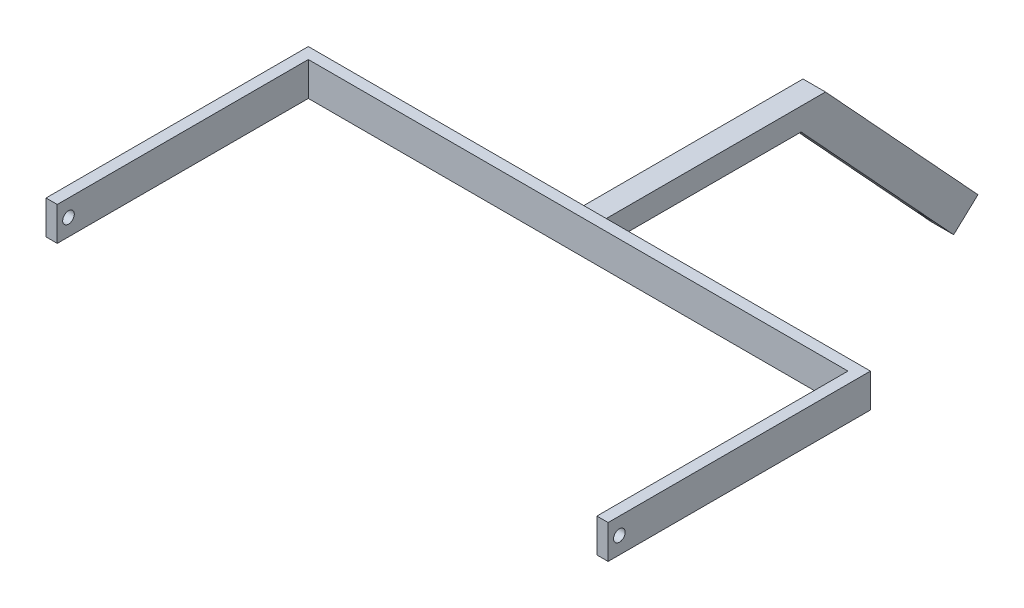
from build123d import *

# Parameters (mm, degrees)
EXTRUDE_2_DEPTH     = 6
SKETCH_2_R          = 1.55
CUT_EXTRUDE_1_DEPTH = 10
SKETCH_3_R          = 1.55
CUT_EXTRUDE_2_DEPTH = 10
EXTRUDE_4_DEPTH     = 1.5
EXTRUDE_5_DEPTH     = 1.5
SKETCH_5_W          = 6
SKETCH_5_H          = 6
EXTRUDE_6_DEPTH     = 60
CUT_EXTRUDE_3_DEPTH = 60
SKETCH_9_W          = 6
SKETCH_9_H          = 8.845903007
EXTRUDE_7_DEPTH     = 60
SKETCH_11_R         = 1.55
CUT_EXTRUDE_5_DEPTH = 10
SKETCH_10_W         = 5
SKETCH_10_H         = 6
CUT_EXTRUDE_6_DEPTH = 10


with BuildPart() as part:
    # 草图1 → 凸台-拉伸2 (new body)
    with BuildSketch(Plane(origin=(0, 0, 0), x_dir=(1, 0, 0), z_dir=(0, 1, 0))):
        Polygon((-72.757575758, -68.484848485), (-72.757575758, -1.484848485), (71.242424242, -1.484848485), (71.242424242, -68.484848485), (74.242424242, -68.484848485), (74.242424242, -1.484848485), (74.242424242, 1.515151515), (71.242424242, 1.515151515), (-72.757575758, 1.515151515), (-75.757575758, 1.515151515), (-75.757575758, -1.484848485), (-75.757575758, -68.484848485), align=None)
    extrude(amount=EXTRUDE_2_DEPTH)

    # 草图2 → 切除-拉伸1 (cut)
    with BuildSketch(Plane(origin=(-72.757575758, 0, 0), x_dir=(0, 0, -1), z_dir=(1, 0, 0))):
        with Locations((-65.484848485, 3)):
            Circle(SKETCH_2_R)
    extrude(amount=-CUT_EXTRUDE_1_DEPTH, mode=Mode.SUBTRACT)

    # 草图3 → 切除-拉伸2 (cut)
    with BuildSketch(Plane(origin=(74.242424242, 0, 0), x_dir=(0, 0, -1), z_dir=(1, 0, 0))):
        with Locations((-65.484848485, 3)):
            Circle(SKETCH_3_R)
    extrude(amount=-CUT_EXTRUDE_2_DEPTH, mode=Mode.SUBTRACT)

    # 草图6 → 凸台-拉伸4 (add)
    with BuildSketch(Plane(origin=(0, 6, 0), x_dir=(1, 0, 0), z_dir=(0, 1, 0))):
        Polygon((-75.757575758, 1.515151515), (74.242424242, 1.515151515), (74.242424242, -68.484848485), (71.242424242, -68.484848485), (71.242424242, -1.484848485), (-72.757575758, -1.484848485), (-72.757575758, -68.484848485), (-75.757575758, -68.484848485), align=None)
    extrude(amount=EXTRUDE_4_DEPTH)

    # 草图7 → 凸台-拉伸5 (add)
    with BuildSketch(Plane.XZ):
        Polygon((-75.757575758, 68.484848485), (-75.757575758, -1.515151515), (74.242424242, -1.515151515), (74.242424242, 68.484848485), (71.242424242, 68.484848485), (71.242424242, 1.484848485), (-72.757575758, 1.484848485), (-72.757575758, 68.484848485), align=None)
    extrude(amount=EXTRUDE_5_DEPTH)

    # 草图5 → 凸台-拉伸6 (add)
    with BuildSketch(Plane(origin=(0, 0, -1.515151515), x_dir=(-1, 0, 0), z_dir=(0, 0, -1))):
        with Locations((0.757575758, 3)):
            Rectangle(SKETCH_5_W, SKETCH_5_H)
    extrude(amount=EXTRUDE_6_DEPTH)

    # 草图8 → 切除-拉伸3 (cut)
    with BuildSketch(Plane(origin=(2.242424242, 0, 0), x_dir=(0, 0, -1), z_dir=(1, 0, 0))):
        Polygon((61.515151515, 6), (55.015151515, 0), (61.515151515, 0), align=None)
    extrude(amount=-CUT_EXTRUDE_3_DEPTH, mode=Mode.SUBTRACT)

    # 草图9 → 凸台-拉伸7 (add)
    with BuildSketch(Plane(origin=(0, -27.419692129, -25.310485042), x_dir=(1, 0, 0), z_dir=(0, -0.7348034446274878, -0.678280102733066))):
        with Locations((-0.757575758, -44.848274344)):
            Rectangle(SKETCH_9_W, SKETCH_9_H)
    extrude(amount=EXTRUDE_7_DEPTH)

    # 草图11 → 切除-拉伸5 (cut)
    with BuildSketch(Plane(origin=(0, 33.419692129, -36.204666473), x_dir=(-1, 0, 0), z_dir=(0, 0.6782801027330662, -0.7348034446274876))):
        with Locations((0.757575758, -90.315682622)):
            Circle(SKETCH_11_R)
    extrude(amount=-CUT_EXTRUDE_5_DEPTH, mode=Mode.SUBTRACT)

    # 草图10 → 切除-拉伸6 (cut)
    with BuildSketch(Plane(origin=(0, -71.507898807, -66.007291206), x_dir=(1, 0, 0), z_dir=(0, -0.7348034446274876, -0.6782801027330662))):
        with Locations((-0.757575758, -44.848274343)):
            Rectangle(SKETCH_10_W, SKETCH_10_H)
    extrude(amount=-CUT_EXTRUDE_6_DEPTH, mode=Mode.SUBTRACT)


solid = part.part
